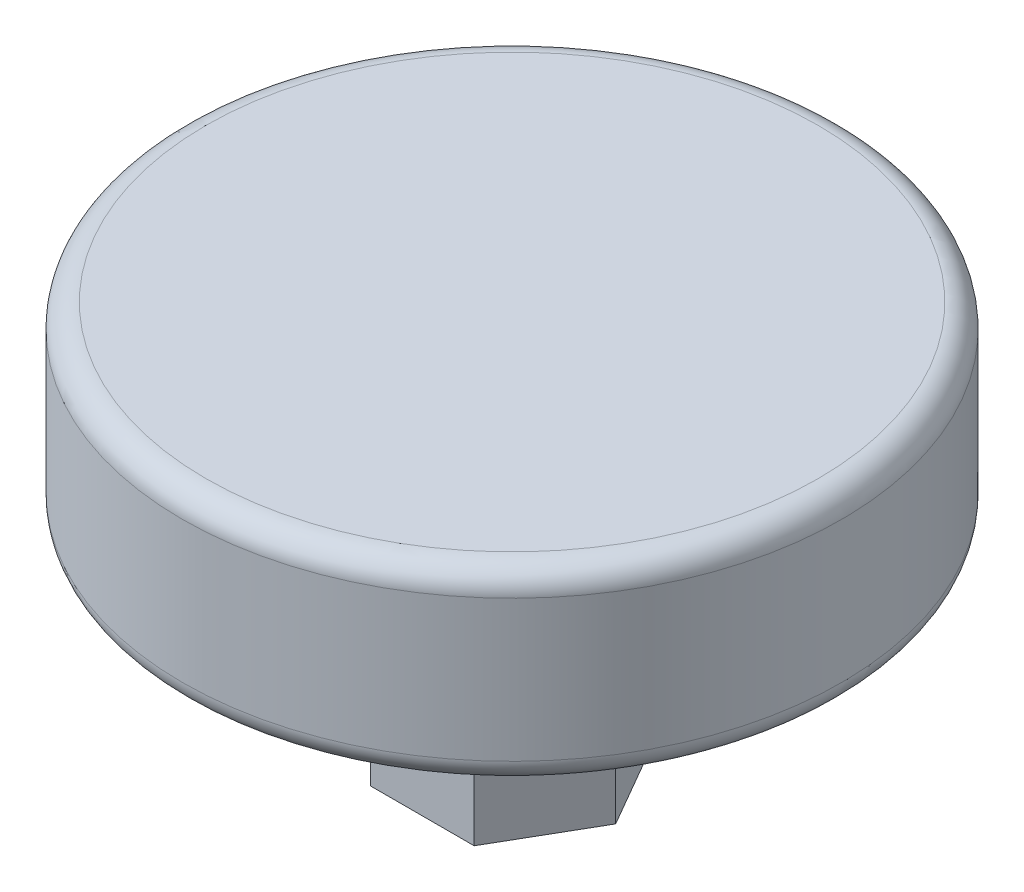
from build123d import *
from OCP.BRepFilletAPI import BRepFilletAPI_MakeChamfer

# Parameters (mm, degrees)
BOSS_EXTRUDE1_DEPTH = 1.75
BOSS_EXTRUDE2_DEPTH = 0.5
BOSS_EXTRUDE5_DEPTH = 3.5
SKETCH4_R           = 3.5
BOSS_EXTRUDE7_DEPTH = 2
SKETCH11_R          = 4.505443821
SKETCH11_R_2        = 3.5
CUT_EXTRUDE3_DEPTH  = 2
SKETCH12_R          = 3.5
CUT_EXTRUDE4_DEPTH  = 3
FILLET3_R           = 0.25
BOSS_EXTRUDE8_DEPTH = 2.5
CHAMFER1_SIZE       = 0.5
CHAMFER1_SIZE2      = 0.288675135


with BuildPart() as part:
    # Sketch1 → Boss-Extrude1 (new body)
    with BuildSketch(Plane(origin=(0, 0, 0), x_dir=(1, 0, 0), z_dir=(0, 1, 0))):
        Polygon((0.658179307, 0), (0.329089653, 0.57), (-0.329089653, 0.57), (-0.658179307, 0), (-0.329089653, -0.57), (0.329089653, -0.57), align=None)
    extrude(amount=BOSS_EXTRUDE1_DEPTH)

    # Sketch2 → Boss-Extrude2 (add)
    with BuildSketch(Plane(origin=(0, 1.75, 0), x_dir=(1, 0, 0), z_dir=(0, 1, 0))):
        Polygon((0, 0.197762982), (0, -0.198641554), (4.375, 0), align=None)
    extrude(amount=BOSS_EXTRUDE2_DEPTH)

    # Sketch3 → Boss-Extrude5 (add)
    with BuildSketch(Plane(origin=(0, 1.75, 0), x_dir=(1, 0, 0), z_dir=(0, 1, 0))):
        Polygon((0.658179307, 0), (0.329089653, 0.57), (-0.329089653, 0.57), (-0.658179307, 0), (-0.329089653, -0.57), (0.329089653, -0.57), align=None)
    extrude(amount=BOSS_EXTRUDE5_DEPTH)

    # Sketch4 → Boss-Extrude7 (add)
    with BuildSketch(Plane(origin=(0, 5.25, 0), x_dir=(1, 0, 0), z_dir=(0, 1, 0))):
        Circle(SKETCH4_R)
    extrude(amount=BOSS_EXTRUDE7_DEPTH)

    # Sketch11 → Cut-Extrude3 (cut)
    with BuildSketch(Plane(origin=(0, 1.75, 0), x_dir=(-1, 0, 0), z_dir=(0, -1, 0))):
        Circle(SKETCH11_R)
        Circle(SKETCH11_R_2, mode=Mode.SUBTRACT)
    extrude(amount=-CUT_EXTRUDE3_DEPTH, mode=Mode.SUBTRACT)

    # Sketch12 → Cut-Extrude4 (cut)
    with BuildSketch(Plane(origin=(0, 0, 0), x_dir=(-1, 0, 0), z_dir=(0, -1, 0))):
        Circle(SKETCH12_R)
    extrude(amount=-CUT_EXTRUDE4_DEPTH, mode=Mode.SUBTRACT)

    # Fillet3
    fillet3_edges = [part.edges().sort_by_distance(p)[0] for p in [
        (-3.5, 7.25, 0),
        (-3.5, 5.25, 0),
    ]]
    fillet(fillet3_edges, radius=FILLET3_R)

    # Sketch16 → Boss-Extrude8 (add)
    with BuildSketch(Plane(origin=(0, 3, 0), x_dir=(-1, 0, 0), z_dir=(0, -1, 0))):
        Polygon((0.55, -0.952627944), (1.1, 0), (0.55, 0.952627944), (-0.55, 0.952627944), (-1.1, 0), (-0.55, -0.952627944), align=None)
    extrude(amount=-BOSS_EXTRUDE8_DEPTH)

    # Chamfer1: one chamfer whose edges measure the first distance from different faces: ONE call of the kernel's chamfer builder (chamfer() names one face for all edges)
    chamfer1_edges_1 = [part.edges().sort_by_distance(p)[0] for p in [
        (0, 5.25, 0.952627944),
    ]]
    chamfer1_side_1 = [part.faces().sort_by_distance(p)[0] for p in [
        (0, 4.125, 0.952627944),
    ]]
    chamfer1_edges_2 = [part.edges().sort_by_distance(p)[0] for p in [
        (-0.825, 5.25, 0.476313972),
    ]]
    chamfer1_side_2 = [part.faces().sort_by_distance(p)[0] for p in [
        (-0.825, 4.125, 0.476313972),
    ]]
    chamfer1_edges_3 = [part.edges().sort_by_distance(p)[0] for p in [
        (-0.825, 5.25, -0.476313972),
    ]]
    chamfer1_side_3 = [part.faces().sort_by_distance(p)[0] for p in [
        (-0.825, 4.125, -0.476313972),
    ]]
    chamfer1_edges_4 = [part.edges().sort_by_distance(p)[0] for p in [
        (0, 5.25, -0.952627944),
    ]]
    chamfer1_side_4 = [part.faces().sort_by_distance(p)[0] for p in [
        (0, 4.125, -0.952627944),
    ]]
    chamfer1_edges_5 = [part.edges().sort_by_distance(p)[0] for p in [
        (0.825, 5.25, -0.476313972),
    ]]
    chamfer1_side_5 = [part.faces().sort_by_distance(p)[0] for p in [
        (0.825, 4.125, -0.476313972),
    ]]
    chamfer1_edges_6 = [part.edges().sort_by_distance(p)[0] for p in [
        (0.825, 5.25, 0.476313972),
    ]]
    chamfer1_side_6 = [part.faces().sort_by_distance(p)[0] for p in [
        (0.825, 4.125, 0.476313972),
    ]]
    chamfer1 = BRepFilletAPI_MakeChamfer(part.part.solid().wrapped)
    for e in chamfer1_edges_1:
        chamfer1.Add(CHAMFER1_SIZE, CHAMFER1_SIZE2, e.wrapped, chamfer1_side_1[0].wrapped)  # the first distance lies on this face
    for e in chamfer1_edges_2:
        chamfer1.Add(CHAMFER1_SIZE, CHAMFER1_SIZE2, e.wrapped, chamfer1_side_2[0].wrapped)  # the first distance lies on this face
    for e in chamfer1_edges_3:
        chamfer1.Add(CHAMFER1_SIZE, CHAMFER1_SIZE2, e.wrapped, chamfer1_side_3[0].wrapped)  # the first distance lies on this face
    for e in chamfer1_edges_4:
        chamfer1.Add(CHAMFER1_SIZE, CHAMFER1_SIZE2, e.wrapped, chamfer1_side_4[0].wrapped)  # the first distance lies on this face
    for e in chamfer1_edges_5:
        chamfer1.Add(CHAMFER1_SIZE, CHAMFER1_SIZE2, e.wrapped, chamfer1_side_5[0].wrapped)  # the first distance lies on this face
    for e in chamfer1_edges_6:
        chamfer1.Add(CHAMFER1_SIZE, CHAMFER1_SIZE2, e.wrapped, chamfer1_side_6[0].wrapped)  # the first distance lies on this face
    add(Compound.cast(chamfer1.Shape()), mode=Mode.REPLACE)


solid = part.part
